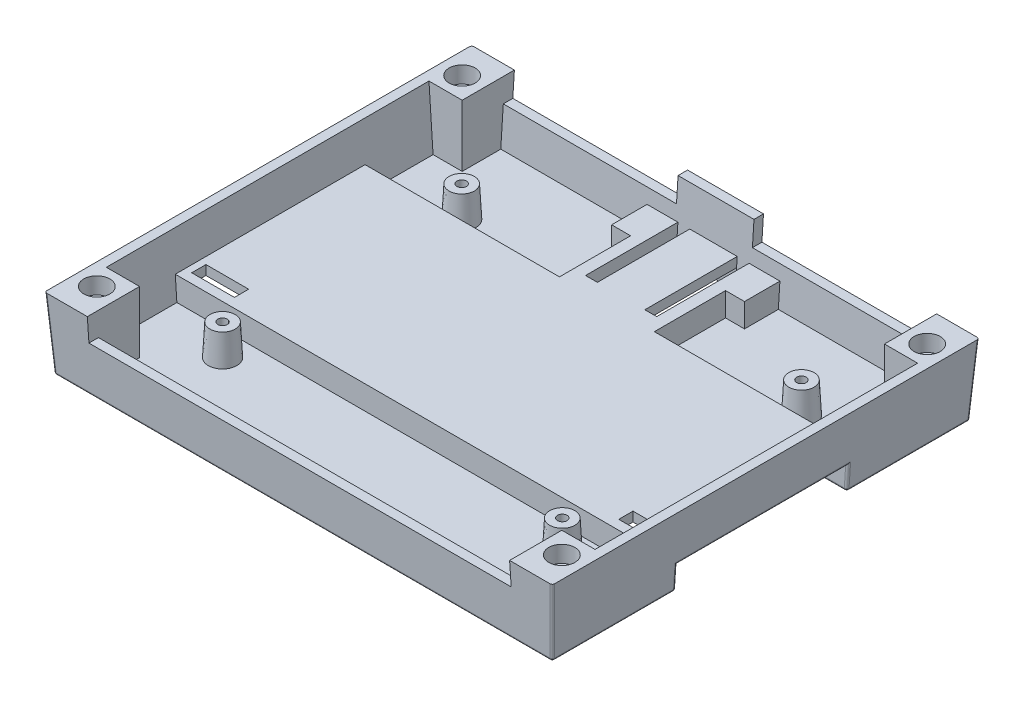
from build123d import *

# Parameters (mm, degrees)
EXTRUDE_1_DEPTH               = 107
CUT_EXTRUDE_2_DEPTH           = 118.042727241
CUT_EXTRUDE_2_DEPTH_BACK      = 118.042727241
SKETCH_3_OUTSIDE_W            = 137.124
SKETCH_3_OUTSIDE_H            = 45.124
FILLET_2_R                    = 0.5
SHELL_START                   = -42.995560483
SHELL_3_DEPTH                 = 85.991120966
SHELL_3_2_DEPTH               = 22.995560483
SHELL_START_2                 = 20
SHELL_3_3_DEPTH               = 22.995560483
SHELL_START_3                 = 1
SHELL_3_4_DEPTH               = 105
SKETCH_4_W                    = 7
SKETCH_4_H                    = 9
EXTRUDE_2_DEPTH               = 13
SKETCH_5_W                    = 36.495560483
SKETCH_5_H                    = 5
CUT_EXTRUDE_3_DEPTH           = 118.042727241
SKETCH_5_5_W                  = 36.495560483
SKETCH_5_5_H                  = 5
SKETCH_5_5_W_2                = 8
CUT_EXTRUDE_4_DEPTH           = 118.042727241
EXTRUDE_START                 = -8
SKETCH_6_W                    = 2.5
SKETCH_6_H                    = 3
EXTRUDE_4_DEPTH               = 5
CUT_EXTRUDE_START             = -15
CUT_EXTRUDE_5_DEPTH           = 5
EXTRUDE_5_DEPTH               = 107
CUT_EXTRUDE_START_2           = -10
SKETCH_7_W                    = 4
SKETCH_7_H                    = 3
SKETCH_7_W_2                  = 81
CUT_EXTRUDE_6_DEPTH           = 108.042727241
SKETCH_7_3_W                  = 9
SKETCH_7_3_H                  = 3
CUT_EXTRUDE_7_DEPTH           = 11.5
SKETCH_8_R                    = 2.75
CUT_EXTRUDE_8_DEPTH           = 3.5
SKETCH_8_3_R                  = 1.25
CUT_EXTRUDE_9_DEPTH           = 12
CUT_EXTRUDE_9_DRAFT           = -2
CUT_EXTRUDE_9_PROFILE_2_DEPTH = 12
CUT_EXTRUDE_9_PROFILE_2_DRAFT = -2
CUT_EXTRUDE_9_PROFILE_3_DEPTH = 12
CUT_EXTRUDE_9_PROFILE_3_DRAFT = -2
CUT_EXTRUDE_9_PROFILE_4_DEPTH = 12
CUT_EXTRUDE_9_PROFILE_4_DRAFT = -2
EXTRUDE_START_2               = -13
SKETCH_9_R                    = 3
EXTRUDE_6_DEPTH               = 6.5
EXTRUDE_6_DRAFT               = 3
EXTRUDE_6_PROFILE_2_DEPTH     = 6.5
EXTRUDE_6_PROFILE_2_DRAFT     = 3
EXTRUDE_6_PROFILE_3_DEPTH     = 6.5
EXTRUDE_6_PROFILE_3_DRAFT     = 3
EXTRUDE_6_PROFILE_4_DEPTH     = 6.5
EXTRUDE_6_PROFILE_4_DRAFT     = 3
SKETCH_9_3_R                  = 1
CUT_EXTRUDE_10_DEPTH          = 13


with BuildPart() as part:
    # Эскиз1 → Бобышка-Вытянуть1 (new body)
    with BuildSketch(Plane(origin=(0, 0, 0), x_dir=(0, 0, -1), z_dir=(1, 0, 0))):
        Polygon((18, -15), (44, -15), (45, 0), (-45, 0), (-44, -15), (-18, -15), (-18, -10), (18, -10), align=None)
    extrude(amount=EXTRUDE_1_DEPTH)

    # Эскиз3 outside → Вырез-Вытянуть2 (cut, two sides: drawn at the far end of the back side and taken through both)
    with BuildSketch(Plane.XY.offset(-CUT_EXTRUDE_2_DEPTH_BACK)):
        with Locations((53.5, -7.5)):
            Rectangle(SKETCH_3_OUTSIDE_W, SKETCH_3_OUTSIDE_H)
        Polygon((0, 0), (1, -15), (106, -15), (107, 0), align=None, mode=Mode.SUBTRACT)
    extrude(amount=CUT_EXTRUDE_2_DEPTH + CUT_EXTRUDE_2_DEPTH_BACK, mode=Mode.SUBTRACT)

    # Скругление2
    fillet_2_edges = [part.edges().sort_by_distance(p)[0] for p in [
        (53.5, -15, 18),
        (53.5, -15, 44),
        (53.5, -15, -44),
        (53.5, -15, -18),
        (1, -15, -31),
        (1, -15, 31),
        (106, -15, -31),
        (106.166666667, -12.5, -18),
        (106.333333333, -10, 0),
        (106, -15, 31),
        (106.5, -7.5, 44.5),
        (106.166666667, -12.5, 18),
        (0.5, -7.5, 44.5),
        (0.666666667, -10, 0),
        (0.833333333, -12.5, -18),
        (0.833333333, -12.5, 18),
        (106.5, -7.5, -44.5),
        (0.5, -7.5, -44.5),
    ]]
    fillet(fillet_2_edges, radius=FILLET_2_R)

    # Оболочка3: read off the stored shape, not the designer's step
    # Оболочка3 outline → Оболочка3 (cut)
    with BuildSketch(Plane.XY.offset(SHELL_START)):
        Polygon((2.004439517, 0), (2.537772851, -8), (104.46222715, -8), (104.995560483, 0), align=None)
    extrude(amount=SHELL_3_DEPTH, mode=Mode.SUBTRACT)

    # Shell 3 2 outline → Shell 3 2 (cut)
    with BuildSketch(Plane.XY.offset(SHELL_START)):
        Polygon((104.46222715, -8), (2.53777285, -8), (2.871106184, -13), (104.128893816, -13), align=None)
    extrude(amount=SHELL_3_2_DEPTH, mode=Mode.SUBTRACT)

    # Shell 3 3 outline → Shell 3 3 (cut)
    with BuildSketch(Plane.XY.offset(SHELL_START_2)):
        Polygon((104.46222715, -8), (2.53777285, -8), (2.871106184, -13), (104.128893816, -13), align=None)
    extrude(amount=SHELL_3_3_DEPTH, mode=Mode.SUBTRACT)

    # Shell 3 4 outline → Shell 3 4 (add)
    with BuildSketch(Plane.YZ.offset(SHELL_START_3)):
        Polygon((-13, -42.995560483), (0, -42.995560483), (-13, -42.128893816), align=None)
        Polygon((-13, 42.128893816), (0, 42.995560483), (-13, 42.995560483), align=None)
    extrude(amount=SHELL_3_4_DEPTH)

    # Эскиз4 → Бобышка-Вытянуть2 (add)
    with BuildSketch(Plane(origin=(0, 0, 0), x_dir=(1, 0, 0), z_dir=(0, 1, 0))):
        with Locations((101.495560483, 38.495560483)):
            Rectangle(SKETCH_4_W, SKETCH_4_H)
        with Locations((5.504439517, 38.495560483)):
            Rectangle(SKETCH_4_W, SKETCH_4_H)
        with Locations((101.495560483, -38.495560483)):
            Rectangle(SKETCH_4_W, SKETCH_4_H)
        with Locations((5.504439517, -38.495560483)):
            Rectangle(SKETCH_4_W, SKETCH_4_H)
    extrude(amount=-EXTRUDE_2_DEPTH)

    # Эскиз5 → Вырез-Вытянуть3 (cut, through all)
    with BuildSketch(Plane.XY):
        with Locations((27.252219759, -2.5)):
            Rectangle(SKETCH_5_W, SKETCH_5_H)
        with Locations((79.747780242, -2.5)):
            Rectangle(SKETCH_5_W, SKETCH_5_H)
    extrude(amount=-CUT_EXTRUDE_3_DEPTH, mode=Mode.SUBTRACT)

    # Эскиз5<5> → Вырез-Вытянуть4 (cut, through all)
    with BuildSketch(Plane.XY):
        with Locations((79.747780242, -2.5)):
            Rectangle(SKETCH_5_5_W, SKETCH_5_5_H)
        with Locations((57.5, -2.5)):
            Rectangle(SKETCH_5_5_W_2, SKETCH_5_5_H)
        with Locations((49.5, -2.5)):
            Rectangle(SKETCH_5_5_W_2, SKETCH_5_5_H)
        with Locations((27.252219759, -2.5)):
            Rectangle(SKETCH_5_5_W, SKETCH_5_5_H)
    extrude(amount=CUT_EXTRUDE_4_DEPTH, mode=Mode.SUBTRACT)

    # Эскиз6 → Бобышка-Вытянуть4 (add)
    with BuildSketch(Plane(origin=(0, 0, 0), x_dir=(1, 0, 0), z_dir=(0, 1, 0)).offset(EXTRUDE_START)):
        Polygon((67.5, 43), (61, 43), (61, 23), (63.5, 23), (63.5, 35), (67.5, 35), align=None)
        with Locations((62.25, 21.5)):
            Rectangle(SKETCH_6_W, SKETCH_6_H)
        Polygon((58.5, 43), (53.5, 43), (53.5, 20), (61, 20), (61, 23), (58.5, 23), align=None)
        Polygon((53.5, 20), (53.5, 43), (48.5, 43), (48.5, 23), (46, 23), (46, 20), align=None)
        with Locations((44.75, 21.5)):
            Rectangle(SKETCH_6_W, SKETCH_6_H)
        Polygon((46, 23), (46, 43), (39.5, 43), (39.5, 35), (43.5, 35), (43.5, 23), align=None)
    extrude(amount=-EXTRUDE_4_DEPTH)

    # Вырез-Вытянуть5: read off the stored shape, not the designer's step
    # Вырез-Вытянуть5 outline → Вырез-Вытянуть5 (cut)
    with BuildSketch(Plane(origin=(0, 0, 0), x_dir=(1, 0, 0), z_dir=(0, 1, 0)).offset(CUT_EXTRUDE_START)):
        Polygon((48.5, 23), (46, 23), (46, 18), (61, 18), (61, 23), (58.5, 23), (58.5, 43), (48.5, 43), align=None)
    extrude(amount=CUT_EXTRUDE_5_DEPTH, mode=Mode.SUBTRACT)

    # Эскиз1<3> → Бобышка-Вытянуть5 (add)
    with BuildSketch(Plane(origin=(0, 0, 0), x_dir=(0, 0, -1), z_dir=(1, 0, 0))):
        Polygon((-16.5, -11.5), (-18, -11.5), (-18, -14.5), align=None)
    extrude(amount=EXTRUDE_5_DEPTH)

    # Эскиз7 → Вырез-Вытянуть6 (cut, through all)
    with BuildSketch(Plane(origin=(0, 0, 0), x_dir=(1, 0, 0), z_dir=(0, 1, 0)).offset(CUT_EXTRUDE_START_2)):
        with Locations((2, -16.5)):
            Rectangle(SKETCH_7_W, SKETCH_7_H)
        with Locations((53.5, -16.5)):
            Rectangle(SKETCH_7_W_2, SKETCH_7_H)
        with Locations((105, -16.5)):
            Rectangle(SKETCH_7_W, SKETCH_7_H)
    extrude(amount=-CUT_EXTRUDE_6_DEPTH, mode=Mode.SUBTRACT)

    # Эскиз7<3> → Вырез-Вытянуть7 (cut)
    with BuildSketch(Plane(origin=(0, 0, 0), x_dir=(1, 0, 0), z_dir=(0, 1, 0))):
        with Locations((98.5, -16.5)):
            Rectangle(SKETCH_7_3_W, SKETCH_7_3_H)
        with Locations((8.5, -16.5)):
            Rectangle(SKETCH_7_3_W, SKETCH_7_3_H)
    extrude(amount=-CUT_EXTRUDE_7_DEPTH, mode=Mode.SUBTRACT)

    # Эскиз8 → Вырез-Вытянуть8 (cut)
    with BuildSketch(Plane(origin=(0, 0, 0), x_dir=(1, 0, 0), z_dir=(0, 1, 0))):
        with Locations(Location((4.5, 38.5, 0), (0, 0, 270))):
            Circle(SKETCH_8_R)
        with Locations(Location((102.5, 38.5, 0), (0, 0, 90))):
            Circle(SKETCH_8_R)
        with Locations(Location((102.5, -38.5, 0), (0, 0, 270))):
            Circle(SKETCH_8_R)
        with Locations(Location((4.5, -38.5, 0), (0, 0, 90))):
            Circle(SKETCH_8_R)
    extrude(amount=-CUT_EXTRUDE_8_DEPTH, mode=Mode.SUBTRACT)


with BuildPart() as cut_extrude_9_tool:
    # Эскиз8<3> → Вырез-Вытянуть9 (with draft: the straight prism first)
    with BuildSketch(Plane(origin=(0, 0, 0), x_dir=(1, 0, 0), z_dir=(0, 1, 0))):
        with Locations((102.5, 38.5)):
            Circle(SKETCH_8_3_R)
    extrude(amount=-CUT_EXTRUDE_9_DEPTH)
    # Вырез-Вытянуть9: the draft: its side faces are tilted about the plane it starts from
    cut_extrude_9_sides = [cut_extrude_9_tool.faces().sort_by_distance(p)[0] for p in [
        (101.25, -6, -38.5),
    ]]
    draft(cut_extrude_9_sides, Plane(origin=(0, 0, 0), x_dir=(1, 0, 0), z_dir=(0, 1, 0)), CUT_EXTRUDE_9_DRAFT)


with BuildPart() as part_1:
    add(part.part)

    # Вырез-Вытянуть9: cut by cut_extrude_9_tool
    add(cut_extrude_9_tool.part, mode=Mode.SUBTRACT)


with BuildPart() as cut_extrude_9_profile_2_tool:
    # Эскиз8<3> → Вырез-Вытянуть9 profile 2 (with draft: the straight prism first)
    with BuildSketch(Plane(origin=(0, 0, 0), x_dir=(1, 0, 0), z_dir=(0, 1, 0))):
        with Locations((4.5, 38.5)):
            Circle(SKETCH_8_3_R)
    extrude(amount=-CUT_EXTRUDE_9_PROFILE_2_DEPTH)
    # Вырез-Вытянуть9 profile 2: the draft: its side faces are tilted about the plane it starts from
    cut_extrude_9_profile_2_sides = [cut_extrude_9_profile_2_tool.faces().sort_by_distance(p)[0] for p in [
        (3.25, -6, -38.5),
    ]]
    draft(cut_extrude_9_profile_2_sides, Plane(origin=(0, 0, 0), x_dir=(1, 0, 0), z_dir=(0, 1, 0)), CUT_EXTRUDE_9_PROFILE_2_DRAFT)


with BuildPart() as part_2:
    add(part_1.part)

    # Вырез-Вытянуть9 profile 2: cut by cut_extrude_9_profile_2_tool
    add(cut_extrude_9_profile_2_tool.part, mode=Mode.SUBTRACT)


with BuildPart() as cut_extrude_9_profile_3_tool:
    # Эскиз8<3> → Вырез-Вытянуть9 profile 3 (with draft: the straight prism first)
    with BuildSketch(Plane(origin=(0, 0, 0), x_dir=(1, 0, 0), z_dir=(0, 1, 0))):
        with Locations((4.5, -38.5)):
            Circle(SKETCH_8_3_R)
    extrude(amount=-CUT_EXTRUDE_9_PROFILE_3_DEPTH)
    # Вырез-Вытянуть9 profile 3: the draft: its side faces are tilted about the plane it starts from
    cut_extrude_9_profile_3_sides = [cut_extrude_9_profile_3_tool.faces().sort_by_distance(p)[0] for p in [
        (3.25, -6, 38.5),
    ]]
    draft(cut_extrude_9_profile_3_sides, Plane(origin=(0, 0, 0), x_dir=(1, 0, 0), z_dir=(0, 1, 0)), CUT_EXTRUDE_9_PROFILE_3_DRAFT)


with BuildPart() as part_3:
    add(part_2.part)

    # Вырез-Вытянуть9 profile 3: cut by cut_extrude_9_profile_3_tool
    add(cut_extrude_9_profile_3_tool.part, mode=Mode.SUBTRACT)


with BuildPart() as cut_extrude_9_profile_4_tool:
    # Эскиз8<3> → Вырез-Вытянуть9 profile 4 (with draft: the straight prism first)
    with BuildSketch(Plane(origin=(0, 0, 0), x_dir=(1, 0, 0), z_dir=(0, 1, 0))):
        with Locations((102.5, -38.5)):
            Circle(SKETCH_8_3_R)
    extrude(amount=-CUT_EXTRUDE_9_PROFILE_4_DEPTH)
    # Вырез-Вытянуть9 profile 4: the draft: its side faces are tilted about the plane it starts from
    cut_extrude_9_profile_4_sides = [cut_extrude_9_profile_4_tool.faces().sort_by_distance(p)[0] for p in [
        (101.25, -6, 38.5),
    ]]
    draft(cut_extrude_9_profile_4_sides, Plane(origin=(0, 0, 0), x_dir=(1, 0, 0), z_dir=(0, 1, 0)), CUT_EXTRUDE_9_PROFILE_4_DRAFT)


with BuildPart() as part_4:
    add(part_3.part)

    # Вырез-Вытянуть9 profile 4: cut by cut_extrude_9_profile_4_tool
    add(cut_extrude_9_profile_4_tool.part, mode=Mode.SUBTRACT)


with BuildPart() as extrude_6_tool:
    # Эскиз9 → Бобышка-Вытянуть6 (with draft: the straight prism first)
    with BuildSketch(Plane(origin=(0, 0, 0), x_dir=(1, 0, 0), z_dir=(0, 1, 0)).offset(EXTRUDE_START_2)):
        with Locations((17.7, 25.2)):
            Circle(SKETCH_9_R)
    extrude(amount=EXTRUDE_6_DEPTH)
    # Бобышка-Вытянуть6: the draft: its side faces are tilted about the plane it starts from
    extrude_6_sides = [extrude_6_tool.faces().sort_by_distance(p)[0] for p in [
        (14.7, -9.75, -25.2),
    ]]
    draft(extrude_6_sides, Plane(origin=(0, 0, 0), x_dir=(1, 0, 0), z_dir=(0, 1, 0)).offset(EXTRUDE_START_2), EXTRUDE_6_DRAFT)


with BuildPart() as part_5:
    add(part_4.part)

    # Бобышка-Вытянуть6: add extrude_6_tool
    add(extrude_6_tool.part)


with BuildPart() as extrude_6_profile_2_tool:
    # Эскиз9 → Бобышка-Вытянуть6 profile 2 (with draft: the straight prism first)
    with BuildSketch(Plane(origin=(0, 0, 0), x_dir=(1, 0, 0), z_dir=(0, 1, 0)).offset(EXTRUDE_START_2)):
        with Locations((89.3, 25.2)):
            Circle(SKETCH_9_R)
    extrude(amount=EXTRUDE_6_PROFILE_2_DEPTH)
    # Бобышка-Вытянуть6 profile 2: the draft: its side faces are tilted about the plane it starts from
    extrude_6_profile_2_sides = [extrude_6_profile_2_tool.faces().sort_by_distance(p)[0] for p in [
        (86.3, -9.75, -25.2),
    ]]
    draft(extrude_6_profile_2_sides, Plane(origin=(0, 0, 0), x_dir=(1, 0, 0), z_dir=(0, 1, 0)).offset(EXTRUDE_START_2), EXTRUDE_6_PROFILE_2_DRAFT)


with BuildPart() as part_6:
    add(part_5.part)

    # Бобышка-Вытянуть6 profile 2: add extrude_6_profile_2_tool
    add(extrude_6_profile_2_tool.part)


with BuildPart() as extrude_6_profile_3_tool:
    # Эскиз9 → Бобышка-Вытянуть6 profile 3 (with draft: the straight prism first)
    with BuildSketch(Plane(origin=(0, 0, 0), x_dir=(1, 0, 0), z_dir=(0, 1, 0)).offset(EXTRUDE_START_2)):
        with Locations((89.3, -25.2)):
            Circle(SKETCH_9_R)
    extrude(amount=EXTRUDE_6_PROFILE_3_DEPTH)
    # Бобышка-Вытянуть6 profile 3: the draft: its side faces are tilted about the plane it starts from
    extrude_6_profile_3_sides = [extrude_6_profile_3_tool.faces().sort_by_distance(p)[0] for p in [
        (86.3, -9.75, 25.2),
    ]]
    draft(extrude_6_profile_3_sides, Plane(origin=(0, 0, 0), x_dir=(1, 0, 0), z_dir=(0, 1, 0)).offset(EXTRUDE_START_2), EXTRUDE_6_PROFILE_3_DRAFT)


with BuildPart() as part_7:
    add(part_6.part)

    # Бобышка-Вытянуть6 profile 3: add extrude_6_profile_3_tool
    add(extrude_6_profile_3_tool.part)


with BuildPart() as extrude_6_profile_4_tool:
    # Эскиз9 → Бобышка-Вытянуть6 profile 4 (with draft: the straight prism first)
    with BuildSketch(Plane(origin=(0, 0, 0), x_dir=(1, 0, 0), z_dir=(0, 1, 0)).offset(EXTRUDE_START_2)):
        with Locations((17.7, -25.2)):
            Circle(SKETCH_9_R)
    extrude(amount=EXTRUDE_6_PROFILE_4_DEPTH)
    # Бобышка-Вытянуть6 profile 4: the draft: its side faces are tilted about the plane it starts from
    extrude_6_profile_4_sides = [extrude_6_profile_4_tool.faces().sort_by_distance(p)[0] for p in [
        (14.7, -9.75, 25.2),
    ]]
    draft(extrude_6_profile_4_sides, Plane(origin=(0, 0, 0), x_dir=(1, 0, 0), z_dir=(0, 1, 0)).offset(EXTRUDE_START_2), EXTRUDE_6_PROFILE_4_DRAFT)


with BuildPart() as part_8:
    add(part_7.part)

    # Бобышка-Вытянуть6 profile 4: add extrude_6_profile_4_tool
    add(extrude_6_profile_4_tool.part)

    # Эскиз9<3> → Вырез-Вытянуть10 (cut)
    with BuildSketch(Plane(origin=(0, 0, 0), x_dir=(1, 0, 0), z_dir=(0, 1, 0))):
        with Locations(Location((17.7, 25.2, 0), (0, 0, 270))):
            Circle(SKETCH_9_3_R)
        with Locations(Location((89.3, 25.2, 0), (0, 0, 90))):
            Circle(SKETCH_9_3_R)
        with Locations(Location((89.3, -25.2, 0), (0, 0, 270))):
            Circle(SKETCH_9_3_R)
        with Locations(Location((17.7, -25.2, 0), (0, 0, 90))):
            Circle(SKETCH_9_3_R)
    extrude(amount=-CUT_EXTRUDE_10_DEPTH, mode=Mode.SUBTRACT)


solid = part_8.part
